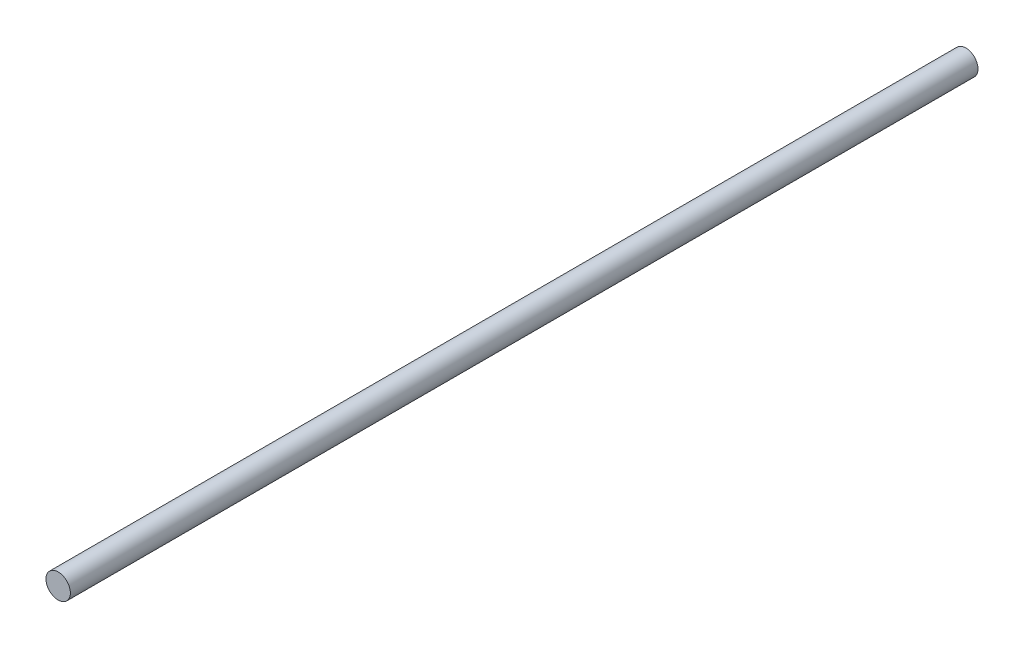
from build123d import *

# Parameters (mm, degrees)
SKETCH3_R           = 25
BOSS_EXTRUDE1_DEPTH = 1861.1


with BuildPart() as part:
    # Sketch3 → Boss-Extrude1 (new body)
    with BuildSketch(Plane.XY):
        Circle(SKETCH3_R)
    extrude(amount=-BOSS_EXTRUDE1_DEPTH)


solid = part.part
